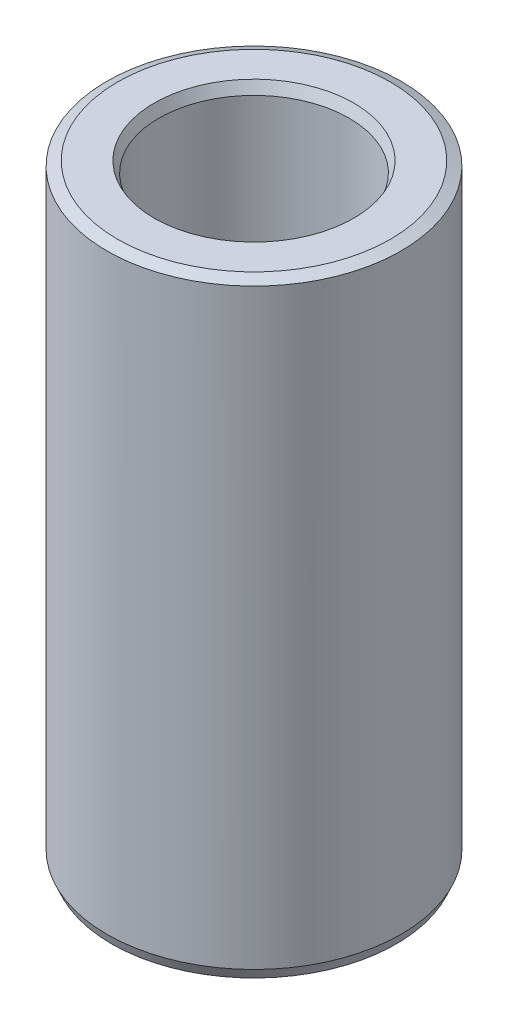
from build123d import *
from OCP.BRepFilletAPI import BRepFilletAPI_MakeChamfer

# Parameters (mm, degrees)
SKETCH1_R           = 30
BOSS_EXTRUDE1_DEPTH = 123.885257496
SKETCH2_R           = 19.398409835
CUT_EXTRUDE1_DEPTH  = 131.948680882
CHAMFER1_SIZE       = 0.961259898
CHAMFER1_SIZE2      = 2.186474521


with BuildPart() as part:
    # Sketch1 → Boss-Extrude1 (new body)
    with BuildSketch(Plane(origin=(0, 0, 0), x_dir=(1, 0, 0), z_dir=(0, 1, 0))):
        Circle(SKETCH1_R)
    extrude(amount=BOSS_EXTRUDE1_DEPTH)

    # Sketch2 → Cut-Extrude1 (cut, through all)
    with BuildSketch(Plane(origin=(0, 0, 0), x_dir=(1, 0, 0), z_dir=(0, 1, 0))):
        Circle(SKETCH2_R)
    extrude(amount=CUT_EXTRUDE1_DEPTH, mode=Mode.SUBTRACT)

    # Chamfer1: one chamfer whose edges measure the first distance from different faces: ONE call of the kernel's chamfer builder (chamfer() names one face for all edges)
    chamfer1_edges_1 = [part.edges().sort_by_distance(p)[0] for p in [
        (-19.398409835, 123.885257496, 0),
    ]]
    chamfer1_side_1 = [part.faces().sort_by_distance(p)[0] for p in [
        (-29.151471863, 123.885257496, 0),
    ]]
    chamfer1_edges_2 = [part.edges().sort_by_distance(p)[0] for p in [
        (-19.398409835, 0, 0),
    ]]
    chamfer1_side_2 = [part.faces().sort_by_distance(p)[0] for p in [
        (-19.398409835, 61.942628748, 0),
    ]]
    chamfer1_edges_3 = [part.edges().sort_by_distance(p)[0] for p in [
        (-30, 0, 0),
    ]]
    chamfer1_side_3 = [part.faces().sort_by_distance(p)[0] for p in [
        (-29.151471863, 0, 0),
    ]]
    chamfer1_edges_4 = [part.edges().sort_by_distance(p)[0] for p in [
        (-30, 123.885257496, 0),
    ]]
    chamfer1_side_4 = [part.faces().sort_by_distance(p)[0] for p in [
        (-30, 61.942628748, 0),
    ]]
    chamfer1 = BRepFilletAPI_MakeChamfer(part.part.solid().wrapped)
    for e in chamfer1_edges_1:
        chamfer1.Add(CHAMFER1_SIZE, CHAMFER1_SIZE2, e.wrapped, chamfer1_side_1[0].wrapped)  # the first distance lies on this face
    for e in chamfer1_edges_2:
        chamfer1.Add(CHAMFER1_SIZE, CHAMFER1_SIZE2, e.wrapped, chamfer1_side_2[0].wrapped)  # the first distance lies on this face
    for e in chamfer1_edges_3:
        chamfer1.Add(CHAMFER1_SIZE, CHAMFER1_SIZE2, e.wrapped, chamfer1_side_3[0].wrapped)  # the first distance lies on this face
    for e in chamfer1_edges_4:
        chamfer1.Add(CHAMFER1_SIZE, CHAMFER1_SIZE2, e.wrapped, chamfer1_side_4[0].wrapped)  # the first distance lies on this face
    add(Compound.cast(chamfer1.Shape()), mode=Mode.REPLACE)


solid = part.part
